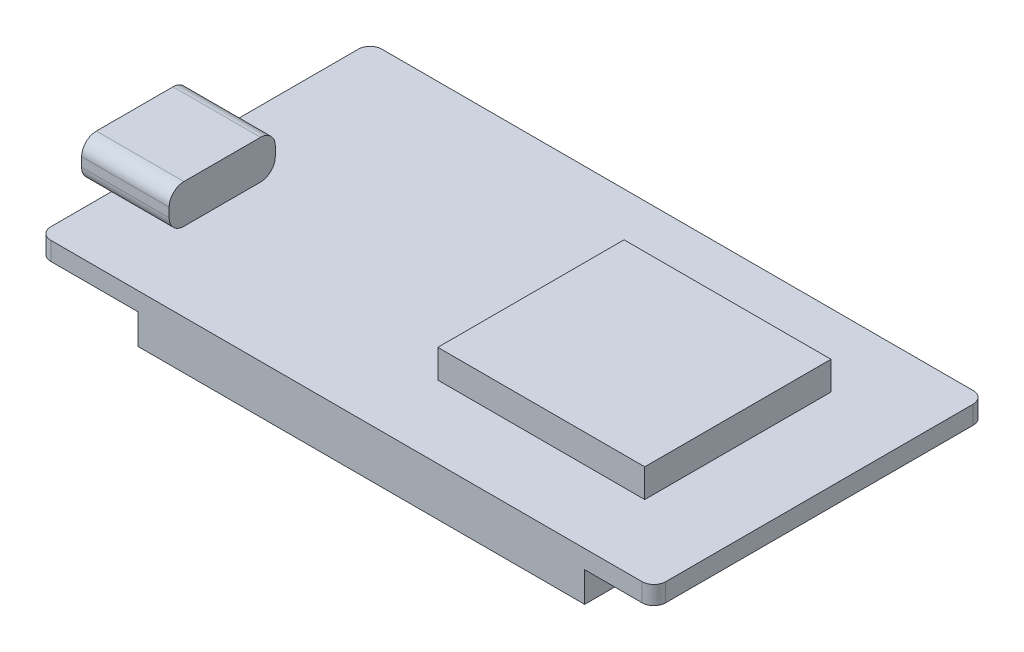
from build123d import *

# Parameters (mm, degrees)
SKETCH_1_W           = 52
SKETCH_1_H           = 28
EXTRUDE_1_DEPTH      = 1.55
FILLET_1_R           = 1
SKETCH_2_W           = 37.76
SKETCH_2_H           = 2.54
EXTRUDE_2_DEPTH      = 2.54
SKETCH_3_W           = 17.5
SKETCH_3_H           = 15.75
EXTRUDE_4_DEPTH      = 2.4
EXTRUDE_6_DEPTH      = 1.8
EXTRUDE_6_DEPTH_BACK = 5.6


with BuildPart() as part:
    # 草圖1 → 填料-伸長1 (new body)
    with BuildSketch(Plane(origin=(0, 0, 0), x_dir=(1, 0, 0), z_dir=(0, 1, 0))):
        Rectangle(SKETCH_1_W, SKETCH_1_H)
    extrude(amount=EXTRUDE_1_DEPTH)

    # 圓角1
    fillet_1_edges = [part.edges().sort_by_distance(p)[0] for p in [
        (26, 0.775, -14),
        (-26, 0.775, -14),
        (-26, 0.775, 14),
        (26, 0.775, 14),
    ]]
    fillet(fillet_1_edges, radius=FILLET_1_R)

    # 草圖2 → 填料-伸長2 (add)
    with BuildSketch(Plane.XZ):
        with Locations((1.27, 12.73)):
            Rectangle(SKETCH_2_W, SKETCH_2_H)
        with Locations((1.27, -12.73)):
            Rectangle(SKETCH_2_W, SKETCH_2_H)
    extrude(amount=EXTRUDE_2_DEPTH)

    # 草圖3 → 填料-伸長4 (add)
    with BuildSketch(Plane(origin=(0, 1.55, 0), x_dir=(1, 0, 0), z_dir=(0, 1, 0))):
        with Locations((10.35, 0)):
            Rectangle(SKETCH_3_W, SKETCH_3_H)
    extrude(amount=EXTRUDE_4_DEPTH)

    # 草圖5 → 填料-伸長6 (add, two sides: drawn at the far end of the back side and taken through both)
    with BuildSketch(Plane.ZY.offset(26).offset(-EXTRUDE_6_DEPTH_BACK)):
        with BuildLine():
            Line((7.35, 1.55), (0.87, 1.55))
            ThreePointArc((0.87, 1.55), (-0.013883476, 1.916116524), (-0.38, 2.8))
            Line((-0.38, 2.8), (-0.38, 3.58))
            ThreePointArc((-0.38, 3.58), (-0.013883476, 4.463883476), (0.87, 4.83))
            Line((0.87, 4.83), (7.35, 4.83))
            ThreePointArc((7.35, 4.83), (8.233883476, 4.463883476), (8.6, 3.58))
            Line((8.6, 3.58), (8.6, 2.8))
            ThreePointArc((8.6, 2.8), (8.233883476, 1.916116524), (7.35, 1.55))
        make_face()
    extrude(amount=EXTRUDE_6_DEPTH + EXTRUDE_6_DEPTH_BACK)


solid = part.part
